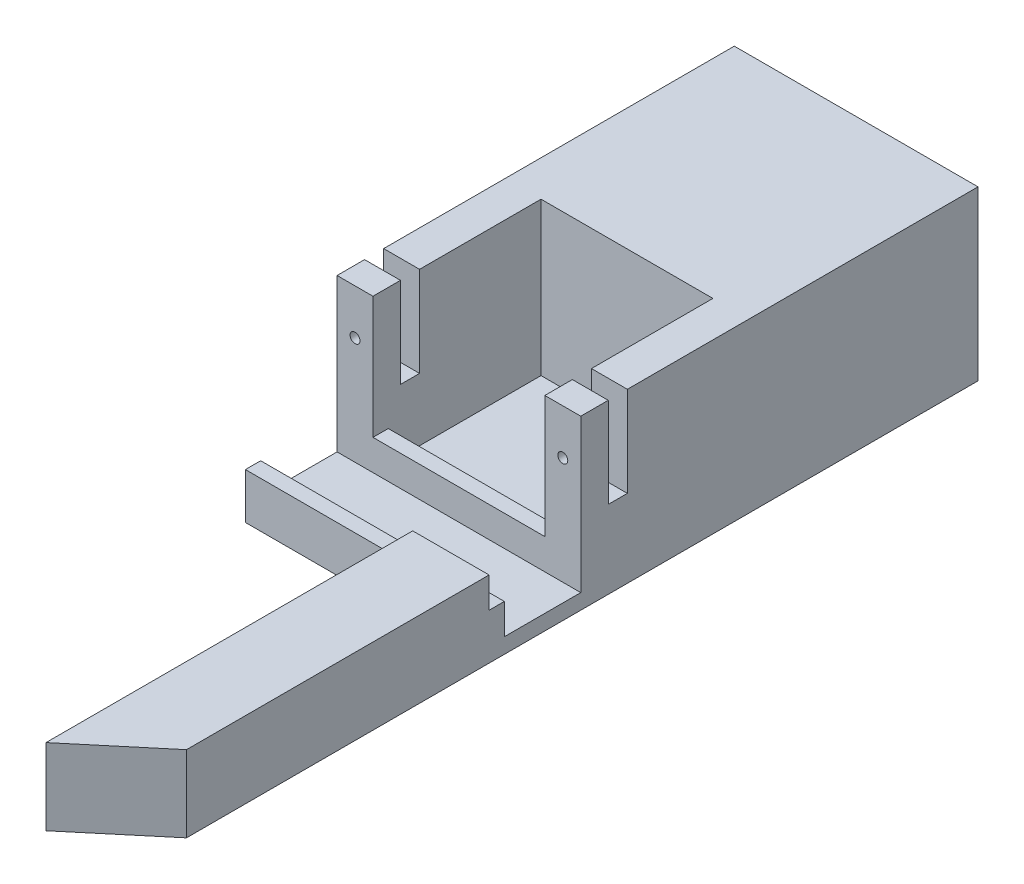
from build123d import *

# Parameters (mm, degrees)
SKETCH1_W           = 31.9
SKETCH1_H           = 34
BOSS_EXTRUDE3_DEPTH = 2
SKETCH2_W           = 4.7
SKETCH2_H           = 22
BOSS_EXTRUDE4_DEPTH = 20
SKETCH3_W           = 22.5
SKETCH3_H           = 2
SKETCH3_W_2         = 31.9
BOSS_EXTRUDE5_DEPTH = 4
SKETCH6_W           = 31.9
SKETCH6_H           = 2.5
CUT_EXTRUDE1_DEPTH  = 11.8
SKETCH7_R           = 0.65
CUT_EXTRUDE2_DEPTH  = 4
BOSS_EXTRUDE6_DEPTH = 10
SKETCH9_W           = 31.9
SKETCH9_H           = 22
BOSS_EXTRUDE7_DEPTH = 30
CUT_EXTRUDE3_DEPTH  = 6
CUT_EXTRUDE7_DEPTH  = 15


with BuildPart() as part:
    # Sketch1 → Boss-Extrude3 (new body)
    with BuildSketch(Plane(origin=(0, 0, 0), x_dir=(1, 0, 0), z_dir=(0, 1, 0))):
        Rectangle(SKETCH1_W, SKETCH1_H)
    extrude(amount=BOSS_EXTRUDE3_DEPTH)

    # Sketch2 → Boss-Extrude4 (add)
    with BuildSketch(Plane(origin=(0, 2, 0), x_dir=(1, 0, 0), z_dir=(0, 1, 0))):
        with Locations((-13.6, 6)):
            Rectangle(SKETCH2_W, SKETCH2_H)
        with Locations((13.6, 6)):
            Rectangle(SKETCH2_W, SKETCH2_H)
    extrude(amount=BOSS_EXTRUDE4_DEPTH)

    # Sketch3 → Boss-Extrude5 (add)
    with BuildSketch(Plane(origin=(0, 2, 0), x_dir=(1, 0, 0), z_dir=(0, 1, 0))):
        with Locations((0, -4)):
            Rectangle(SKETCH3_W, SKETCH3_H)
        with Locations((0, -16)):
            Rectangle(SKETCH3_W_2, SKETCH3_H)
    extrude(amount=BOSS_EXTRUDE5_DEPTH)

    # Sketch6 → Cut-Extrude1 (cut)
    with BuildSketch(Plane(origin=(0, 22, 0), x_dir=(1, 0, 0), z_dir=(0, 1, 0))):
        with Locations((0, -0.15)):
            Rectangle(SKETCH6_W, SKETCH6_H)
    extrude(amount=-CUT_EXTRUDE1_DEPTH, mode=Mode.SUBTRACT)

    # Sketch7 → Cut-Extrude2 (cut)
    with BuildSketch(Plane.XY.offset(5)):
        with Locations((-13.6, 16.1)):
            Circle(SKETCH7_R)
        with Locations((13.6, 16.1)):
            Circle(SKETCH7_R)
    extrude(amount=-CUT_EXTRUDE2_DEPTH, mode=Mode.SUBTRACT)

    # Sketch8 → Boss-Extrude6 (add)
    with BuildSketch(Plane(origin=(0, 0, 0), x_dir=(1, 0, 0), z_dir=(0, 1, 0))):
        Polygon((5.95, -65), (15.95, -56.609003688), (15.95, -17), (5.95, -17), align=None)
    extrude(amount=BOSS_EXTRUDE6_DEPTH)

    # Sketch9 → Boss-Extrude7 (add)
    with BuildSketch(Plane(origin=(0, 0, -17), x_dir=(-1, 0, 0), z_dir=(0, 0, -1))):
        with Locations((0, 11)):
            Rectangle(SKETCH9_W, SKETCH9_H)
    extrude(amount=BOSS_EXTRUDE7_DEPTH)

    # Sketch10 → Cut-Extrude3 (cut)
    with BuildSketch(Plane(origin=(0, 0, -47), x_dir=(-1, 0, 0), z_dir=(0, 0, -1))):
        with BuildLine():
            Line((4.235, 11), (4.235, 0))
            ThreePointArc((4.235, 0), (0, -4.235), (-4.235, 0))
            Line((-4.235, 0), (-4.235, 11))
            ThreePointArc((-4.235, 11), (0, 15.235), (4.235, 11))
        make_face()
    extrude(amount=-CUT_EXTRUDE3_DEPTH, mode=Mode.SUBTRACT)

    # Sketch11 → Cut-Extrude7 (cut)
    with BuildSketch(Plane(origin=(0, 0, 0), x_dir=(-1, 0, 0), z_dir=(0, -1, 0))):
        Polygon((-5, 34), (-8.5, 34), (-8.5, 39), (-5, 39), (-5, 41), (5, 41), (5, 39), (8.5, 39), (8.5, 34), (5, 34), (5, 22), (-5, 22), align=None)
    extrude(amount=-CUT_EXTRUDE7_DEPTH, mode=Mode.SUBTRACT)


solid = part.part
